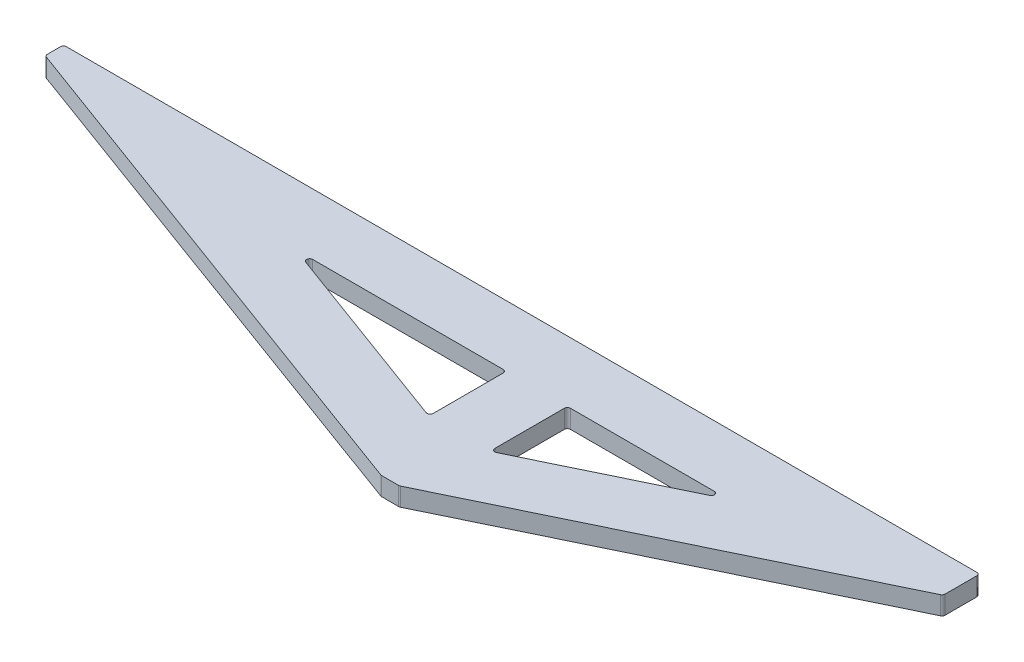
from build123d import *

# Parameters (mm, degrees)
SUPPORT_DEPTH = 6
LITE_DEPTH    = 309.116860947
FILLET_2_R    = 1


with BuildPart() as part:
    # Sketch1 → support (new body)
    with BuildSketch(Plane(origin=(0, 0, 0), x_dir=(1, 0, 0), z_dir=(0, 1, 0))):
        Polygon((0, 0), (300, 0), (300, -12), (180, -70), (174, -70), (0, -6), align=None)
    extrude(amount=SUPPORT_DEPTH)

    # Sketch2 → lite (cut, through all)
    with BuildSketch(Plane(origin=(0, 6, 0), x_dir=(1, 0, 0), z_dir=(0, 1, 0))):
        Polygon((95.999022376, -20), (164.988314579, -20), (164.988314579, -45.375371845), align=None)
        Polygon((184.988314579, -20), (184.988314579, -45.375371845), (237.489083913, -20), align=None)
    extrude(amount=-LITE_DEPTH, mode=Mode.SUBTRACT)

    # fillet 2
    fillet_2_edges = [part.edges().sort_by_distance(p)[0] for p in [
        (300, 3, 0),
        (300, 3, 12),
        (180, 3, 70),
        (174, 3, 70),
        (0, 3, 0),
        (0, 3, 6),
        (237.489083913, 3, 20),
        (184.988314579, 3, 45.375371845),
        (184.988314579, 3, 20),
        (164.988314579, 3, 20),
        (164.988314579, 3, 45.375371845),
        (95.999022376, 3, 20),
    ]]
    fillet(fillet_2_edges, radius=FILLET_2_R)


solid = part.part
